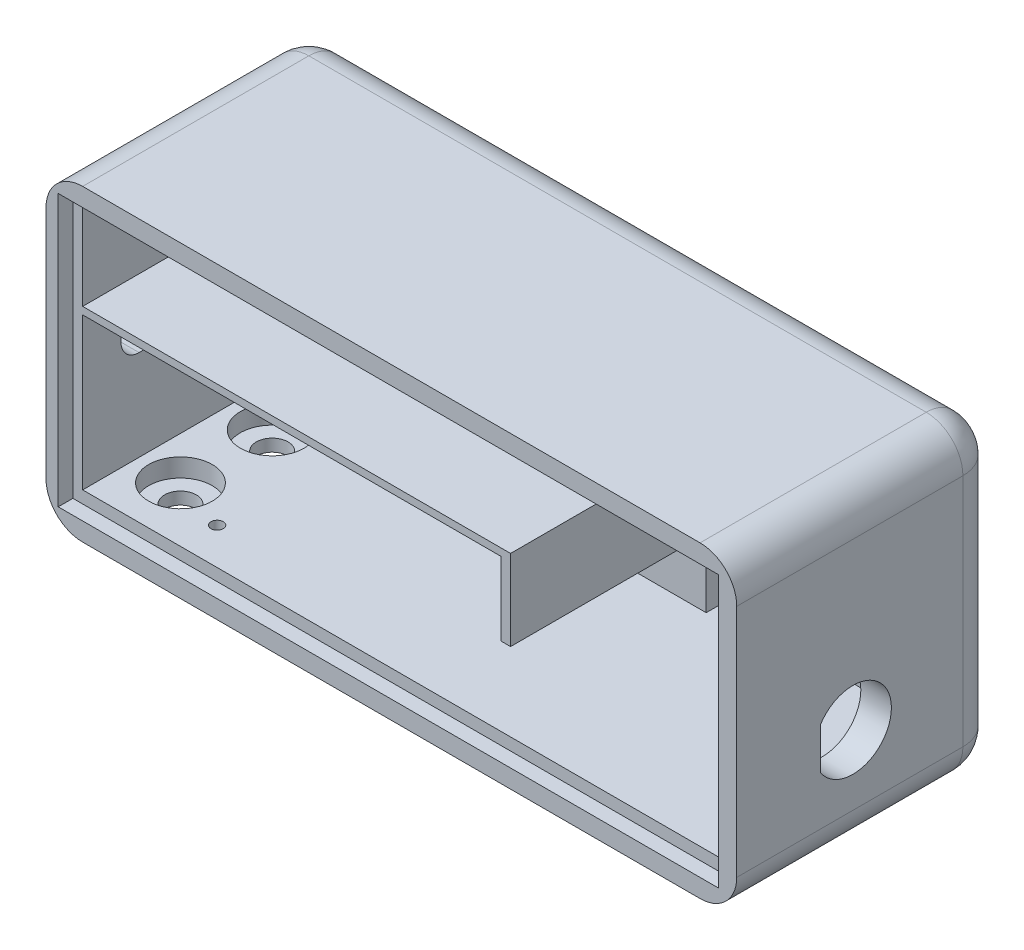
from build123d import *

# Parameters (mm, degrees)
SKETCH_1_W          = 56.5
SKETCH_1_H          = 25.2
EXTRUDE_1_DEPTH     = 19
SKETCH_2_W          = 56.5
SKETCH_2_H          = 25.2
EXTRUDE_2_DEPTH     = 2.5
SKETCH_3_W          = 34.2
SKETCH_3_H          = 12.4
EXTRUDE_3_DEPTH     = 1
CUT_EXTRUDE_1_DEPTH = 1.8
SKETCH_5_W          = 54
SKETCH_5_H          = 22.2
CUT_EXTRUDE_2_DEPTH = 1.2
CUT_EXTRUDE_3_DEPTH = 4.2
FILLET_1_R          = 3
FILLET_2_R          = 3
SKETCH_8_R          = 1.3
CUT_EXTRUDE_4_DEPTH = 4.2
SKETCH_9_R          = 2.6
CUT_EXTRUDE_5_DEPTH = 1.5
SKETCH_10_R         = 0.5
CUT_EXTRUDE_6_DEPTH = 4


with BuildPart() as part:
    # Эскиз1 → Бобышка-Вытянуть1 (new body)
    with BuildSketch(Plane.XY):
        with Locations((-22.317513824, -999.289755901)):
            Rectangle(SKETCH_1_W, SKETCH_1_H)
        Polygon((-48.767513824, -989.189755901), (3.432486176, -989.189755901), (3.432486176, -1009.389755901), (-48.767513824, -1009.389755901), (-48.767513824, -996.989755901), (-14.567513824, -996.989755901), (-14.567513824, -1002.989755901), (-13.767513824, -1002.989755901), (-13.767513824, -996.989755901), (-13.767513824, -996.389755901), (-48.767513824, -996.389755901), align=None, mode=Mode.SUBTRACT)
    extrude(amount=EXTRUDE_1_DEPTH)

    # Эскиз2 → Бобышка-Вытянуть2 (add)
    with BuildSketch(Plane(origin=(0, 0, 0), x_dir=(-1, 0, 0), z_dir=(0, 0, -1))):
        with Locations((22.317513824, -999.289755901)):
            Rectangle(SKETCH_2_W, SKETCH_2_H)
    extrude(amount=EXTRUDE_2_DEPTH)

    # Эскиз3 → Бобышка-Вытянуть3 (add)
    with BuildSketch(Plane.XY):
        with Locations((-31.667513824, -1003.189755901)):
            Rectangle(SKETCH_3_W, SKETCH_3_H)
    extrude(amount=EXTRUDE_3_DEPTH)

    # Эскиз4 → Вырез-Вытянуть1 (cut)
    with BuildSketch(Plane.ZY.offset(50.567513824)):
        with BuildLine():
            Line((14.666630398, -1000.489317936), (14.666630398, -999.889317936))
            ThreePointArc((14.666630398, -999.889317936), (14.233148434, -998.8427999), (13.186630398, -998.409317936))
            Line((13.186630398, -998.409317936), (6.806630398, -998.409317936))
            ThreePointArc((6.806630398, -998.409317936), (5.760112362, -998.8427999), (5.326630398, -999.889317936))
            Line((5.326630398, -999.889317936), (5.326630398, -1000.489317936))
            ThreePointArc((5.326630398, -1000.489317936), (5.760112362, -1001.535835972), (6.806630398, -1001.969317936))
            Line((6.806630398, -1001.969317936), (13.186630398, -1001.969317936))
            ThreePointArc((13.186630398, -1001.969317936), (14.233148434, -1001.535835972), (14.666630398, -1000.489317936))
        make_face()
    extrude(amount=-CUT_EXTRUDE_1_DEPTH, mode=Mode.SUBTRACT)

    # Эскиз5 → Вырез-Вытянуть2 (cut)
    with BuildSketch(Plane.XY.offset(19)):
        with Locations((-22.567513824, -999.289755901)):
            Rectangle(SKETCH_5_W, SKETCH_5_H)
    extrude(amount=-CUT_EXTRUDE_2_DEPTH, mode=Mode.SUBTRACT)

    # Эскиз7 → Вырез-Вытянуть3 (cut)
    with BuildSketch(Plane(origin=(5.932486176, 0, 0), x_dir=(0, 0, -1), z_dir=(1, 0, 0))):
        with BuildLine():
            Line((-12.15, -1001.486817264), (-12.15, -1004.892694537))
            ThreePointArc((-12.15, -1004.892694537), (-6.35, -1003.189755901), (-12.15, -1001.486817264))
        make_face()
    extrude(amount=-CUT_EXTRUDE_3_DEPTH, mode=Mode.SUBTRACT)

    # Скругление1
    fillet_1_edges = [part.edges().sort_by_distance(p)[0] for p in [
        (5.932486176, -999.289755901, -2.5),
        (-22.317513824, -1011.889755901, -2.5),
        (-50.567513824, -999.289755901, -2.5),
        (-22.317513824, -986.689755901, -2.5),
    ]]
    fillet(fillet_1_edges, radius=FILLET_1_R)

    # Скругление2
    # the kernel refuses this fillet: 3 mm, written as the material it takes off along each edge
    with BuildSketch(Plane(origin=(-47.567513824, -1008.889755901, 0.5), x_dir=(0, -1, 0), z_dir=(-1, 0, 0))) as fillet_2_piece_1_section:
        Polygon((0, 0), (FILLET_2_R, 0), (FILLET_2_R, -FILLET_2_R), (0, -FILLET_2_R), align=None)
    fillet_2_piece_1 = extrude(amount=FILLET_2_R, mode=Mode.PRIVATE)
    fillet_2_piece_1 = fillet_2_piece_1 - Plane(origin=(-47.567513824, -1008.889755901, 0.5), x_dir=(0, 0.7071067811865475, 0.7071067811865475), z_dir=(-1, 0, 0)) * Sphere(FILLET_2_R, mode=Mode.PRIVATE)
    add(fillet_2_piece_1, mode=Mode.SUBTRACT)
    with BuildSketch(Plane(origin=(2.932486176, -1008.889755901, 0.5), x_dir=(0, -1, 0), z_dir=(1, 0, 0))) as fillet_2_piece_2_section:
        Polygon((0, 0), (FILLET_2_R, 0), (FILLET_2_R, FILLET_2_R), (0, FILLET_2_R), align=None)
    fillet_2_piece_2 = extrude(amount=FILLET_2_R, mode=Mode.PRIVATE)
    fillet_2_piece_2 = fillet_2_piece_2 - Plane(origin=(2.932486176, -1008.889755901, 0.5), x_dir=(0, 0.7071067811865475, 0.7071067811865475), z_dir=(1, 0, 0)) * Sphere(FILLET_2_R, mode=Mode.PRIVATE)
    add(fillet_2_piece_2, mode=Mode.SUBTRACT)
    with BuildSketch(Plane(origin=(-47.567513824, -989.689755901, 0.5), x_dir=(-1, 0, 0), z_dir=(0, 1, 0))) as fillet_2_piece_3_section:
        Polygon((0, 0), (FILLET_2_R, 0), (FILLET_2_R, -FILLET_2_R), (0, -FILLET_2_R), align=None)
    fillet_2_piece_3 = extrude(amount=FILLET_2_R, mode=Mode.PRIVATE)
    fillet_2_piece_3 = fillet_2_piece_3 - Plane(origin=(-47.567513824, -989.689755901, 0.5), x_dir=(0.7071067811865475, 0, 0.7071067811865475), z_dir=(0, 1, 0)) * Sphere(FILLET_2_R, mode=Mode.PRIVATE)
    add(fillet_2_piece_3, mode=Mode.SUBTRACT)
    with BuildSketch(Plane(origin=(2.932486176, -989.689755901, 0.5), x_dir=(1, 0, 0), z_dir=(0, 1, 0))) as fillet_2_piece_4_section:
        Polygon((0, 0), (FILLET_2_R, 0), (FILLET_2_R, FILLET_2_R), (0, FILLET_2_R), align=None)
    fillet_2_piece_4 = extrude(amount=FILLET_2_R, mode=Mode.PRIVATE)
    fillet_2_piece_4 = fillet_2_piece_4 - Plane(origin=(2.932486176, -989.689755901, 0.5), x_dir=(-0.7071067811865475, 0, 0.7071067811865475), z_dir=(0, 1, 0)) * Sphere(FILLET_2_R, mode=Mode.PRIVATE)
    add(fillet_2_piece_4, mode=Mode.SUBTRACT)
    with BuildSketch(Plane(origin=(-50.567513824, -986.689755901, 0.5), x_dir=(1, 0, 0), z_dir=(0, 0, 1)), Plane(origin=(5.932486176, -986.689755901, 26.5), x_dir=(-1, 0, 0), z_dir=(0, 0, -1)), Plane(origin=(5.932486176, -1011.889755901, 26.5), x_dir=(0, 1, 0), z_dir=(0, 0, -1)), Plane(origin=(-50.567513824, -1011.889755901, 0.5), x_dir=(0, 1, 0), z_dir=(0, 0, 1))) as fillet_2_piece_5:
        with BuildLine():
            CenterArc((FILLET_2_R, -FILLET_2_R), FILLET_2_R, 90, 90)
            Line((0, -FILLET_2_R), (0, 0))
            Line((0, 0), (FILLET_2_R, 0))
        make_face()
    extrude(amount=26, mode=Mode.SUBTRACT)

    # Эскиз8 → Вырез-Вытянуть4 (cut)
    with BuildSketch(Plane.XZ.offset(1011.889755901)):
        with Locations(Location((-45.267513824, 5.8, 0), (0, 0, 270))):
            Circle(SKETCH_8_R)
        with Locations(Location((-45.267513824, 13.3, 0), (0, 0, 270))):
            Circle(SKETCH_8_R)
    extrude(amount=-CUT_EXTRUDE_4_DEPTH, mode=Mode.SUBTRACT)

    # Эскиз9 → Вырез-Вытянуть5 (cut)
    with BuildSketch(Plane(origin=(0, -1009.389755901, 0), x_dir=(1, 0, 0), z_dir=(0, 1, 0))):
        with Locations(Location((-45.267513824, -5.8, 0), (0, 0, 270))):
            Circle(SKETCH_9_R)
        with Locations(Location((-45.267513824, -13.3, 0), (0, 0, 270))):
            Circle(SKETCH_9_R)
    extrude(amount=-CUT_EXTRUDE_5_DEPTH, mode=Mode.SUBTRACT)

    # Эскиз10 → Вырез-Вытянуть6 (cut)
    with BuildSketch(Plane.XZ.offset(1011.889755901)):
        with Locations(Location((-40.767513824, 4.8, 0), (0, 0, 270))):
            Circle(SKETCH_10_R)
        with Locations(Location((-40.767513824, 14.8, 0), (0, 0, 270))):
            Circle(SKETCH_10_R)
    extrude(amount=-CUT_EXTRUDE_6_DEPTH, mode=Mode.SUBTRACT)


solid = part.part
